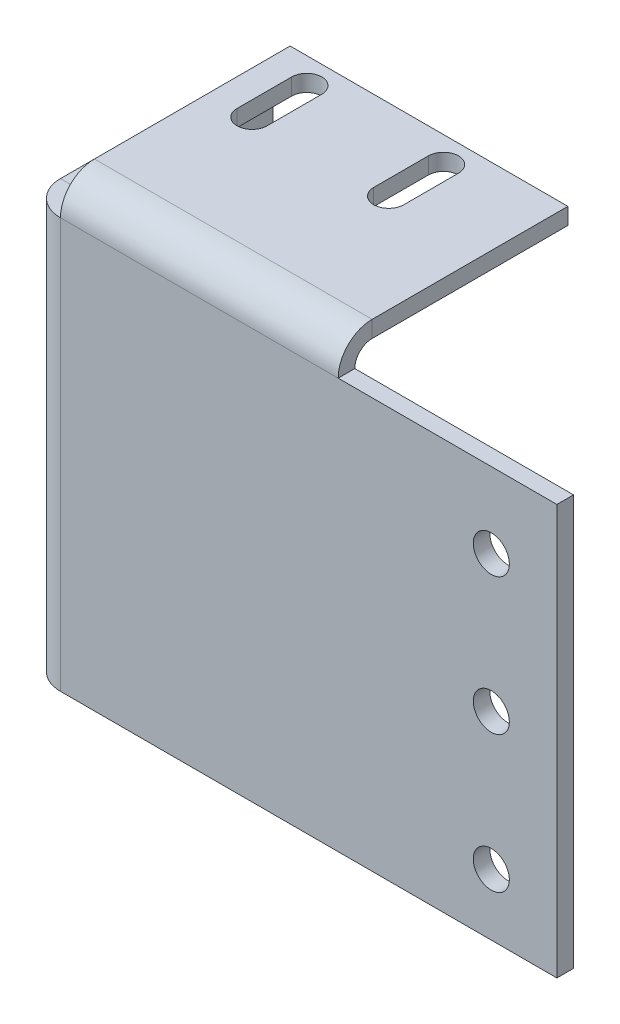
from build123d import *

# Parameters (mm, degrees)
SKETCH1_W                    = 97
SKETCH1_H                    = 75
BASE_FLANGE1_DEPTH           = 3.03784
EDGE_FLANGE1_STRIP_W         = 18.50136
EDGE_FLANGE1_STRIP_H         = 3.03784
EDGE_FLANGE1_STRIP_CUT_DEPTH = 75
EDGE_FLANGE1_DEPTH           = 75
EDGE_FLANGE2_DEPTH           = 50.78716
CUT_EXTRUDE3_DEPTH           = 134.298632329
M6_CLEARANCE_HOLE1_D         = 6.6


# Sheet-metal steps are written as plain solids
with BuildPart() as part:
    # Sketch1 → Base-Flange1 (new body)
    with BuildSketch(Plane.XY):
        with Locations((-48.5, 0)):
            Rectangle(SKETCH1_W, SKETCH1_H)
    extrude(amount=-BASE_FLANGE1_DEPTH)

    # Edge-Flange1 strip (across the edge) → Edge-Flange1 strip cut (cut)
    with BuildSketch(Plane(origin=(-97, -37.5, -3.03784), x_dir=(1, 0, 0), z_dir=(0, 1, 0))):
        with Locations((-3.03784, -1.51892)):
            Rectangle(EDGE_FLANGE1_STRIP_W, EDGE_FLANGE1_STRIP_H)
    extrude(amount=EDGE_FLANGE1_STRIP_CUT_DEPTH, mode=Mode.SUBTRACT)

    # Edge-Flange1 section (across the edge) → Edge-Flange1 (add)
    with BuildSketch(Plane(origin=(-97, -37.5, -3.03784), x_dir=(1, 0, 0), z_dir=(0, 1, 0))):
        with BuildLine():
            Line((0, 3.175), (0, 38.96216))
            Line((0, 38.96216), (3.03784, 38.96216))
            Line((3.03784, 38.96216), (3.03784, 3.175))
            ThreePointArc((3.03784, 3.175), (3.96777597, 0.92993597), (6.21284, 0))
            Line((6.21284, 0), (6.21284, -3.03784))
            ThreePointArc((6.21284, -3.03784), (1.819698706, -1.218141294), (0, 3.175))
        make_face()
    extrude(amount=EDGE_FLANGE1_DEPTH)

    # Edge-Flange2 section (across the edge) → Edge-Flange2 (add)
    with BuildSketch(Plane(origin=(-90.78716, 40.675, -3.03784), x_dir=(0, -1, 0), z_dir=(1, 0, 0))):
        with BuildLine():
            Line((-3.03784, 3.175), (-3.03784, 38.96216))
            Line((-3.03784, 38.96216), (0, 38.96216))
            Line((0, 38.96216), (0, 3.175))
            ThreePointArc((0, 3.175), (0.92993597, 0.92993597), (3.175, 0))
            Line((3.175, 0), (3.175, -3.03784))
            ThreePointArc((3.175, -3.03784), (-1.218141294, -1.218141294), (-3.03784, 3.175))
        make_face()
    extrude(amount=EDGE_FLANGE2_DEPTH)

    # Sketch13 → Cut-Extrude3 (cut, through all)
    with BuildSketch(Plane(origin=(0, 43.71284, 0), x_dir=(1, 0, 0), z_dir=(0, 1, 0))):
        with BuildLine():
            Line((-80.25, 37.25), (-80.25, 27.25))
            ThreePointArc((-80.25, 27.25), (-83, 24.5), (-85.75, 27.25))
            Line((-85.75, 27.25), (-85.75, 37.25))
            ThreePointArc((-85.75, 37.25), (-83, 40), (-80.25, 37.25))
        make_face()
        with BuildLine():
            Line((-55.25, 37.25), (-55.25, 27.25))
            ThreePointArc((-55.25, 27.25), (-58, 24.5), (-60.75, 27.25))
            Line((-60.75, 27.25), (-60.75, 37.25))
            ThreePointArc((-60.75, 37.25), (-58, 40), (-55.25, 37.25))
        make_face()
    extrude(amount=-CUT_EXTRUDE3_DEPTH, mode=Mode.SUBTRACT)

    # M6 Clearance Hole1 (through all)
    with Locations(Plane.XY):
        with Locations((-12, 23.71284), (-12, -26.28716), (-12, -1.28716)):
            Hole(M6_CLEARANCE_HOLE1_D / 2)


solid = part.part
